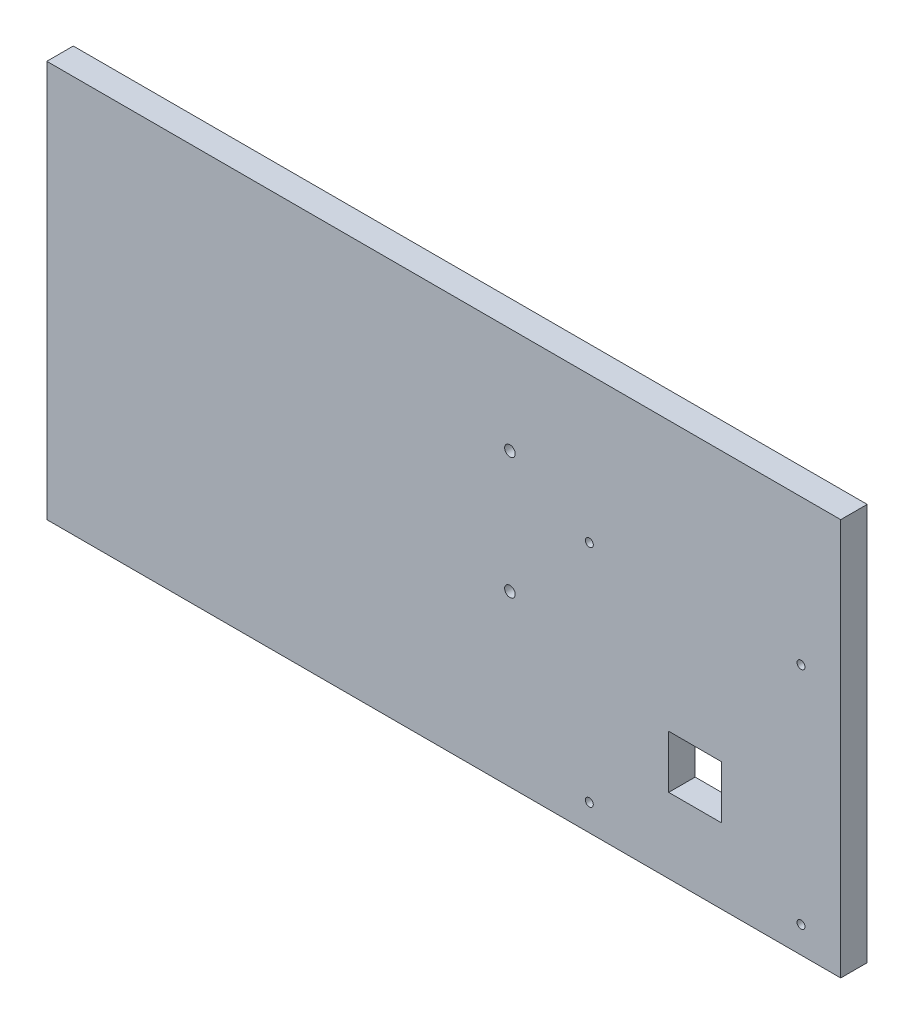
from build123d import *

# Parameters (mm, degrees)
ESBO_O1_W                = 300
ESBO_O1_H                = 150
ESBO_O1_R                = 1.5
ESBO_O1_R_2              = 2
ESBO_O1_W_2              = 20
ESBO_O1_H_2              = 20
RESSALTO_EXTRUS_O1_DEPTH = 10


with BuildPart() as part:
    # Esboço1 → Ressalto-extrusão1 (new body)
    with BuildSketch(Plane.XY):
        Rectangle(ESBO_O1_W, ESBO_O1_H)
        with Locations((55, -65)):
            Circle(ESBO_O1_R, mode=Mode.SUBTRACT)
        with Locations((135, -65)):
            Circle(ESBO_O1_R, mode=Mode.SUBTRACT)
        with Locations((25, -11)):
            Circle(ESBO_O1_R_2, mode=Mode.SUBTRACT)
        with Locations((95, -36.75)):
            Rectangle(ESBO_O1_W_2, ESBO_O1_H_2, mode=Mode.SUBTRACT)
        with Locations((25, 35)):
            Circle(ESBO_O1_R_2, mode=Mode.SUBTRACT)
        with Locations((55, 20)):
            Circle(ESBO_O1_R, mode=Mode.SUBTRACT)
        with Locations((135, 20)):
            Circle(ESBO_O1_R, mode=Mode.SUBTRACT)
    extrude(amount=RESSALTO_EXTRUS_O1_DEPTH)


solid = part.part
